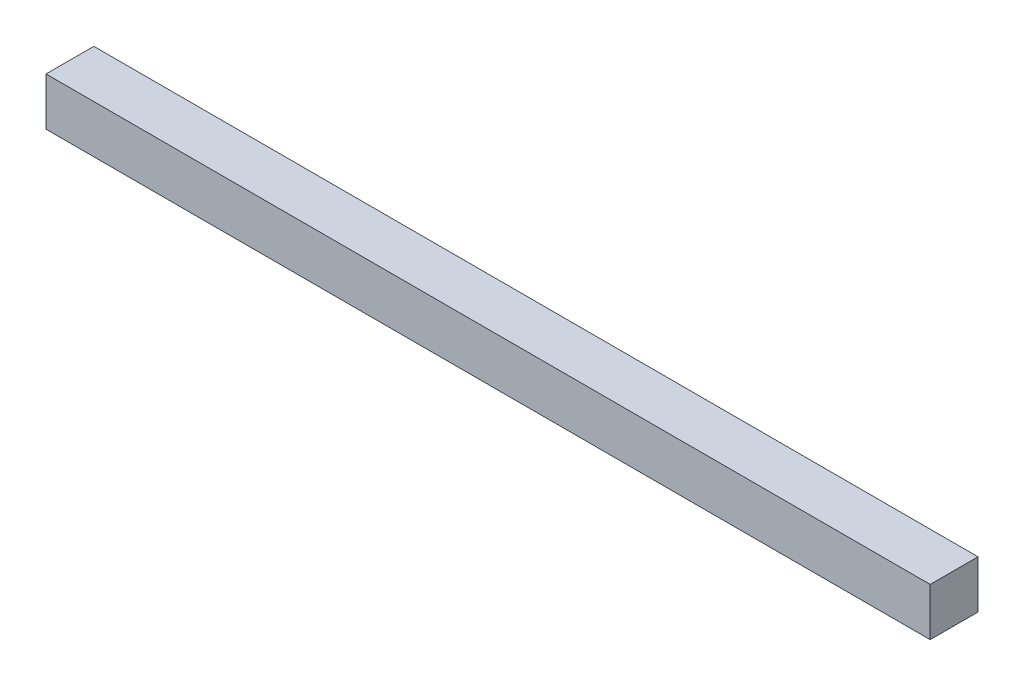
from build123d import *

# Parameters (mm, degrees)
SKETCH1_W           = 58.674
SKETCH1_H           = 3.175
BOSS_EXTRUDE1_DEPTH = 3.175


with BuildPart() as part:
    # Sketch1 → Boss-Extrude1 (new body)
    with BuildSketch(Plane(origin=(0, 0, 0), x_dir=(1, 0, 0), z_dir=(0, 1, 0))):
        with Locations((-29.337, 1.5875)):
            Rectangle(SKETCH1_W, SKETCH1_H)
    extrude(amount=BOSS_EXTRUDE1_DEPTH)


solid = part.part
